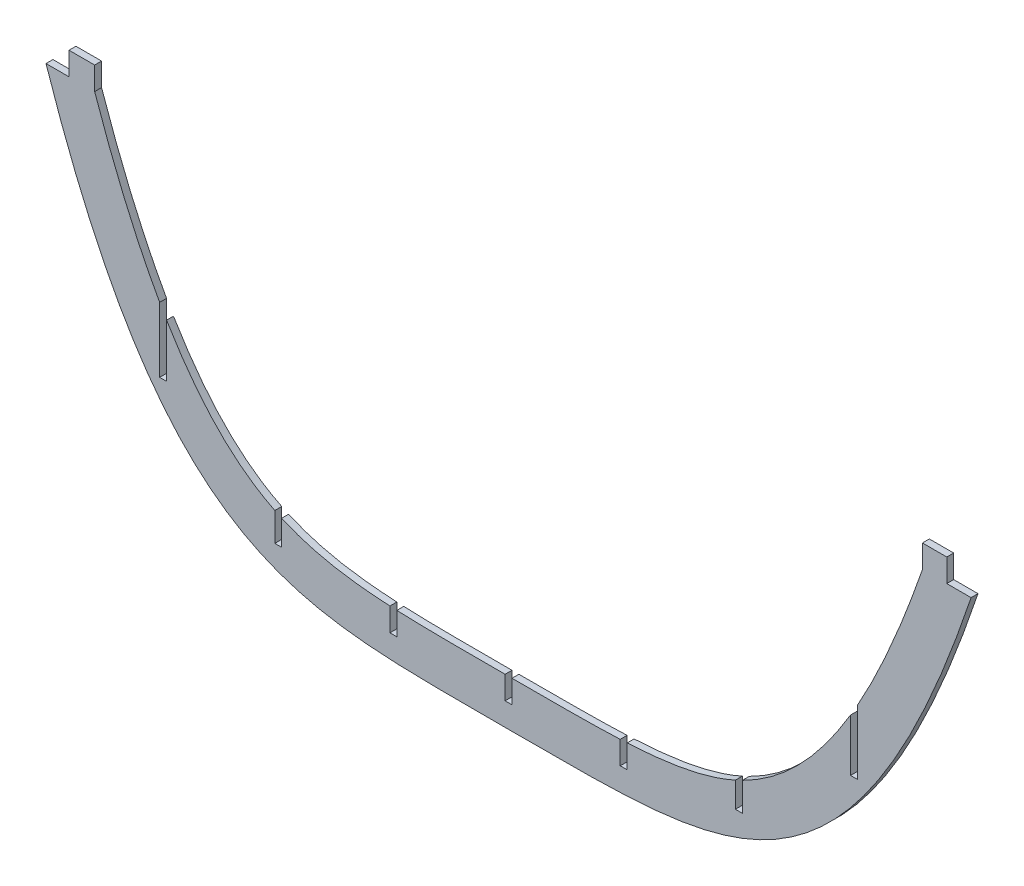
from build123d import *

# Parameters (mm, degrees)
BOSS_EXTRUDE1_DEPTH = 3
SKETCH2_W           = 2.999999902
SKETCH2_H           = 11.368148841
CUT_EXTRUDE2_DEPTH  = 22
SKETCH4_W           = 3
SKETCH4_H           = 12.91245629
CUT_EXTRUDE3_DEPTH  = 45
SKETCH5_W           = 3
SKETCH5_H           = 17.735525731
CUT_EXTRUDE4_DEPTH  = 38
SKETCH6_W           = 3
SKETCH6_H           = 30.838195809
CUT_EXTRUDE5_DEPTH  = 99
CUT_EXTRUDE6_DEPTH  = 239
CUT_EXTRUDE7_DEPTH  = 257.812337222


with BuildPart() as part:
    # Sketch1 → Boss-Extrude1 (new body)
    with BuildSketch(Plane.XY):
        with BuildLine():
            Line((-190.857104702, 159.999999898), (-179.730540998, 159.999999898))
            Line((-179.730540998, 159.999999898), (-179.730540998, 149.999999898))
            add(Edge.make_bspline(
                [(-179.730540998, 149.999999898), (-179.435736296, 149.148237012), (-178.129369144, 145.400432921), (-175.809971547, 138.948879865), (-172.785816947, 130.935113685), (-168.767754042, 120.798312384), (-163.776796782, 109.130589616), (-157.84743559, 96.632896422), (-151.989239921, 85.541409366), (-144.28873539, 72.497307507), (-134.900677689, 59.219307637), (-124.086780391, 47.32628366), (-113.70604162, 38.644244548), (-103.594321478, 32.38075232), (-93.477134717, 27.890378411), (-83.091397363, 24.726267775), (-68.68501467, 21.878302713), (-49.516353483, 20.30417739), (-25.106590618, 19.975287666), (-2.7e-08, 20.012356167), (25.106590565, 19.975287666), (49.516353432, 20.304177388), (68.685014622, 21.878302707), (83.091397317, 24.726267763), (93.477134673, 27.890378394), (103.594321435, 32.380752297), (113.706041576, 38.644244516), (124.086780346, 47.326283616), (134.900677642, 59.219307577), (144.288735341, 72.497307432), (151.989239871, 85.541409276), (157.847435539, 96.632896321), (163.776796731, 109.130589502), (168.76775399, 120.798312259), (172.785816895, 130.93511355), (175.809971495, 138.948879723), (178.1293691, 145.400432798), (179.435736262, 149.148236912), (179.730540973, 149.999999823)],
                knots=[0.041921013, 0.041921013, 0.041921013, 0.041921013, 0.044025323, 0.051263016, 0.05850071, 0.065738403, 0.080213789, 0.094689176, 0.109164563, 0.123639949, 0.152590722, 0.181541495, 0.210492269, 0.239443042, 0.268393815, 0.297344588, 0.326295361, 0.384196907, 0.442098454, 0.5, 0.557901546, 0.615803092, 0.673704639, 0.702655412, 0.731606185, 0.760556958, 0.789507731, 0.818458504, 0.847409278, 0.876360051, 0.890835437, 0.905310824, 0.91978621, 0.934261597, 0.94149929, 0.948736984, 0.955974677, 0.958078987, 0.958078987, 0.958078987, 0.958078987], degree=3))
            Line((179.730540973, 149.999999823), (179.730540973, 159.999999823))
            Line((179.730540973, 159.999999823), (190.29382281, 159.999999823))
            Line((190.29382281, 159.999999823), (190.29382281, 149.999999737))
            Line((190.29382281, 149.999999737), (200.857104648, 149.999999737))
            add(Edge.make_bspline(
                [(-200.857104702, 149.999999898), (-100.428552364, -149.999999855), (-2.7e-08, 149.999999814), (100.42855231, -149.999999774), (200.857104648, 149.999999737)],
                knots=[0.03678763, 0.03678763, 0.03678763, 0.03678763, 0.03678763, 0.96321237, 0.96321237, 0.96321237, 0.96321237, 0.96321237], degree=4))
            Line((-200.857104702, 149.999999898), (-190.857104702, 149.999999898))
            Line((-190.857104702, 149.999999898), (-190.857104702, 159.999999898))
        make_face()
    extrude(amount=BOSS_EXTRUDE1_DEPTH)

    # Sketch2 → Cut-Extrude2 (cut)
    with BuildSketch(Plane.XY):
        with Locations((-4.4e-08, 15.684087839)):
            Rectangle(SKETCH2_W, SKETCH2_H)
    extrude(amount=CUT_EXTRUDE2_DEPTH, mode=Mode.SUBTRACT)

    # Sketch4 → Cut-Extrude3 (cut)
    with BuildSketch(Plane.XY):
        with Locations((99.999999956, 25.672228128)):
            Rectangle(SKETCH4_W, SKETCH4_H)
    extrude(amount=CUT_EXTRUDE3_DEPTH, mode=Mode.SUBTRACT)

    # Sketch5 → Cut-Extrude4 (cut)
    with BuildSketch(Plane.XY):
        with Locations((-100, 28.083762866)):
            Rectangle(SKETCH5_W, SKETCH5_H)
    extrude(amount=CUT_EXTRUDE4_DEPTH, mode=Mode.SUBTRACT)

    # Sketch6 → Cut-Extrude5 (cut)
    with BuildSketch(Plane.XY):
        with Locations((-150, 72.075097905)):
            Rectangle(SKETCH6_W, SKETCH6_H)
    extrude(amount=CUT_EXTRUDE5_DEPTH, mode=Mode.SUBTRACT)

    # Sketch7 → Cut-Extrude6 (cut)
    with BuildSketch(Plane.XY):
        Polygon((148.499999956, 59.949736331), (148.499999956, 86.674548715), (151.499999956, 86.674548715), (151.499999956, 59.949736331), (151.499999956, 56.949736331), (148.499999956, 56.949736331), align=None)
    extrude(amount=CUT_EXTRUDE6_DEPTH, mode=Mode.SUBTRACT)

    # Sketch8 → Cut-Extrude7 (cut, through all)
    with BuildSketch(Plane.XY.offset(3)):
        Polygon((-50, 10.576), (-48.5, 10.576), (-48.5, 27.611636606), (-51.5, 27.611636606), (-51.5, 10.576), align=None)
    cut_extrude7 = extrude(amount=-CUT_EXTRUDE7_DEPTH, mode=Mode.SUBTRACT)

    # Mirror1: Cut-Extrude7 across plane
    add(cut_extrude7.mirror(Plane(origin=(0, 0, 0), x_dir=(0, 0, 1), z_dir=(-1.0, -1.6951361018868004e-09, 0))), mode=Mode.SUBTRACT)


solid = part.part
